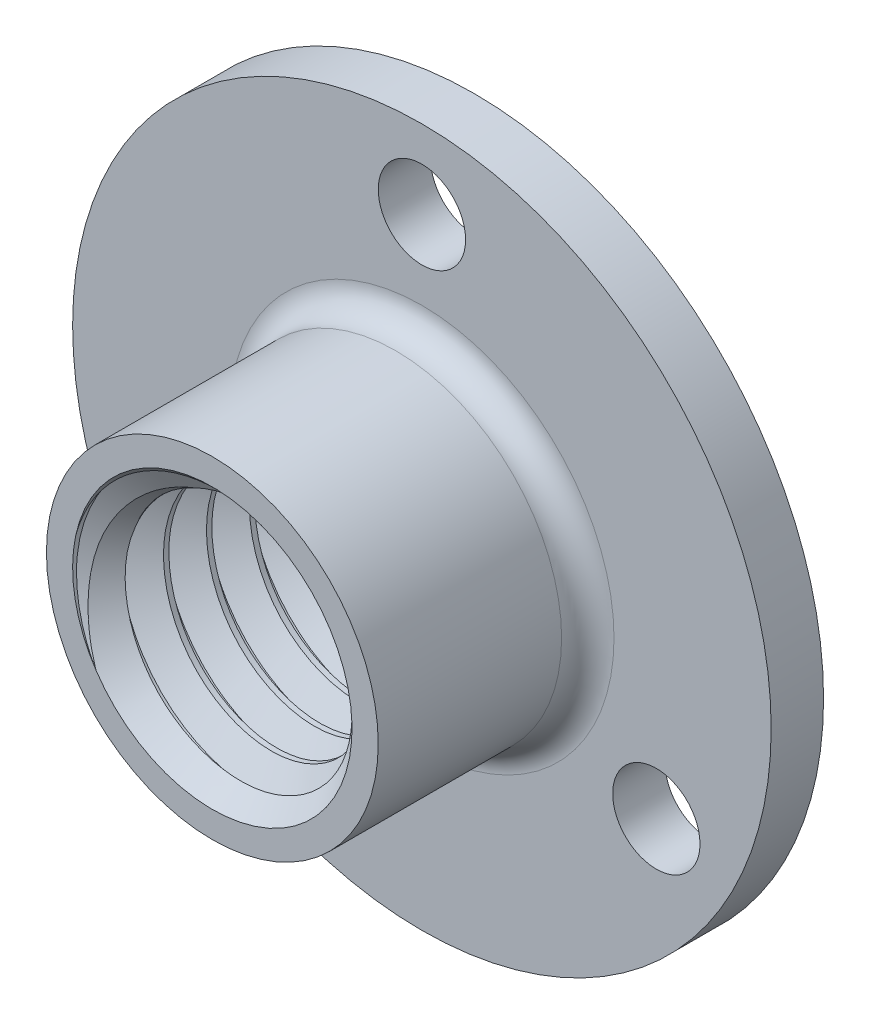
from build123d import *

# Parameters (mm, degrees)
SKETCH1_R          = 15.875
SKETCH1_R_2        = 6.35
EXTRUDE1_DEPTH     = 2.38125
SKETCH2_R          = 7.540625
SKETCH2_R_2        = 6.35
EXTRUDE2_DEPTH     = 9.525
SWEEP1_PITCH       = 1.953846154
SKETCH5_R          = 15.875
CUT_EXTRUDE1_DEPTH = 29.517644531
SKETCH7_R          = 7.540625
CUT_EXTRUDE3_DEPTH = 26.412399364
FILLET1_R          = 1.190625
SKETCH9_R          = 1.984375
CUT_EXTRUDE5_DEPTH = 26.412399364
CIRPATTERN1_COUNT  = 3


with BuildPart() as part:
    # Sketch1 → Extrude1 (new body)
    with BuildSketch(Plane.XY):
        with Locations(Location((0, 0, 0), (0, 0, 180))):
            Circle(SKETCH1_R)
        with Locations(Location((0, 0, 0), (0, 0, 180))):
            Circle(SKETCH1_R_2, mode=Mode.SUBTRACT)
    extrude(amount=EXTRUDE1_DEPTH)

    # Sketch2 → Extrude2 (add)
    with BuildSketch(Plane.XY.offset(2.38125)):
        with Locations(Location((0, 0, 0), (0, 0, 180))):
            Circle(SKETCH2_R)
        with Locations(Location((0, 0, 0), (0, 0, 180))):
            Circle(SKETCH2_R_2, mode=Mode.SUBTRACT)
    extrude(amount=EXTRUDE2_DEPTH)

    # Sweep1: arcs per turn and ends read off the stored shape
    # Sweep1: the profile of Sketch4 profile screwed along a right-hand helix through 9 turns, 6 arcs to a turn; built about Z, then put on its axis
    sweep1_z = Axis((0, 0, 0), (0, 0, 1))
    sweep1_corners = [(6.3503, 0, -1.70978859), (6.3503, 0, 0.000173205), (5.080939697, 0, -0.732692308), (5.080939697, 0, -0.976923077)]
    with BuildLine(mode=Mode.PRIVATE) as sweep1_profile:
        Line(sweep1_corners[0], sweep1_corners[1])
        Line(sweep1_corners[1], sweep1_corners[2])
        Line(sweep1_corners[2], sweep1_corners[3])
        Line(sweep1_corners[3], sweep1_corners[0])
    sweep1_cap = Face(sweep1_profile.wire())
    sweep1_turn_angles = [0, 30, 60, 90, 120, 150, 180, 210, 240, 270, 300, 330, 360]
    sweep1_turn_weights = [1, 0.8660254037844387, 1, 0.8660254037844387, 1, 0.8660254037844387, 1, 0.8660254037844387, 1, 0.8660254037844387, 1, 0.8660254037844387, 1]
    sweep1_turn_rails = [Edge.make_bspline([Vector(p[0], p[1], 0).rotate(sweep1_z, sweep1_turn_angles[k]) / sweep1_turn_weights[k] + Vector(0, 0, p[2] + SWEEP1_PITCH * sweep1_turn_angles[k] / 360) for k in range(13)], [0, 0, 0, 1, 1, 2, 2, 3, 3, 4, 4, 5, 5, 6, 6, 6], 2, sweep1_turn_weights) for p in sweep1_corners]
    sweep1_turn_sides = [Face.make_surface_from_curves(sweep1_turn_rails[p[0]], sweep1_turn_rails[p[1]]) for p in [(0, 1), (1, 2), (2, 3), (3, 0)]]
    sweep1 = Plane(origin=(0, 0, 0), x_dir=(-1, 0, 0), z_dir=(0, 0, 1)) * Solid(Shell([*[p.moved(Location((0, 0, SWEEP1_PITCH * i))) for i in range(9) for p in sweep1_turn_sides], sweep1_cap, sweep1_cap.rotate(sweep1_z, 3240).moved(Location((0, 0, SWEEP1_PITCH * 3240 / 360)))]))
    add(sweep1)

    # Sketch5 → Cut-Extrude1 (cut, through all)
    with BuildSketch(Plane(origin=(0, 0, 0), x_dir=(-1, 0, 0), z_dir=(0, 0, -1))):
        Circle(SKETCH5_R)
    extrude(amount=CUT_EXTRUDE1_DEPTH, mode=Mode.SUBTRACT)

    # Cut-Extrude2 cone 1 section (through the dimple's axis) → Cut-Extrude2 (revolve, cut)
    with BuildSketch(Plane.YZ):
        Polygon((0, 0), (6.35, 0), (0, 6.35), align=None)
    revolve(axis=Axis((0, 0, 0), (0, 0, 1)), mode=Mode.SUBTRACT)

    # Sketch7 → Cut-Extrude3 (cut, through all)
    with BuildSketch(Plane.XY.offset(11.90625)):
        with Locations(Location((0, 0, 0), (0, 0, 180))):
            Circle(SKETCH7_R)
    extrude(amount=CUT_EXTRUDE3_DEPTH, mode=Mode.SUBTRACT)

    # Cut-Extrude4 cone 1 section (through the dimple's axis) → Cut-Extrude4 (revolve, cut)
    with BuildSketch(Plane(origin=(0, 0, 11.90625), x_dir=(0, -1, 0), z_dir=(1, 0, 0))):
        Polygon((0, 0), (6.35, 0), (0, 6.35), align=None)
    revolve(axis=Axis((0, 0, 11.90625), (0, 0, -1)), mode=Mode.SUBTRACT)

    # Fillet1
    fillet1_edges = [part.edges().sort_by_distance(p)[0] for p in [
        (7.540625, 0, 2.38125),
    ]]
    fillet(fillet1_edges, radius=FILLET1_R)

    # Sketch9 → Cut-Extrude5 (cut, through all)
    with BuildSketch(Plane.XY):
        with Locations((0, 12.303125)):
            Circle(SKETCH9_R)
    cut_extrude5 = extrude(amount=CUT_EXTRUDE5_DEPTH, mode=Mode.SUBTRACT)

    # CirPattern1: Cut-Extrude5 ×3 about axis
    cirpattern1_axis = Axis((0, 0, 0), (0, 0, 1))
    for i in range(1, CIRPATTERN1_COUNT):
        add(cut_extrude5.rotate(cirpattern1_axis, i * 360 / CIRPATTERN1_COUNT), mode=Mode.SUBTRACT)


solid = part.part
